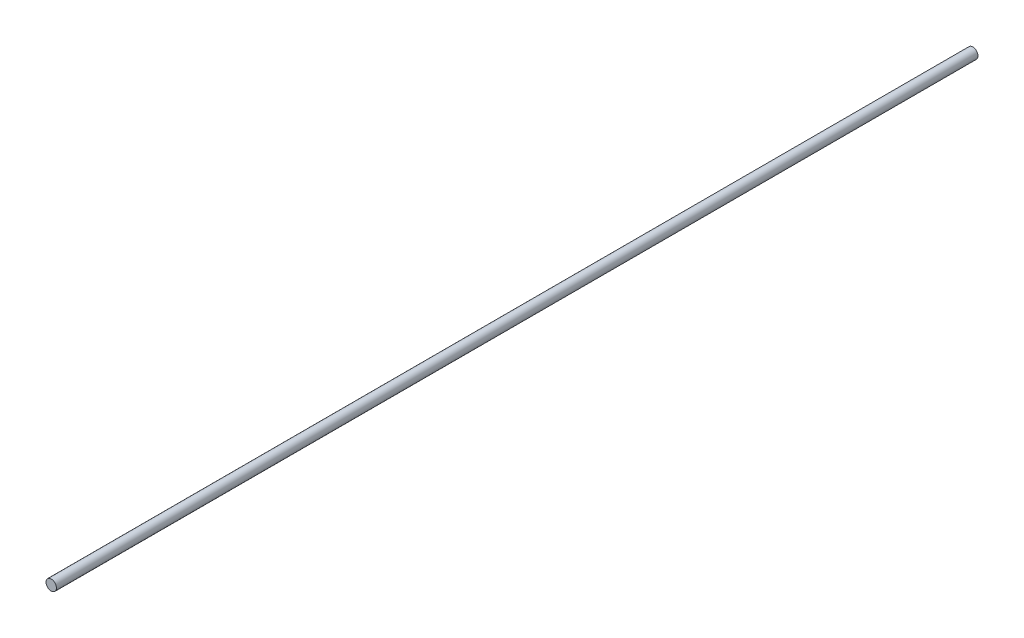
from build123d import *

# Parameters (mm, degrees)
SKETCH1_R           = 4
BOSS_EXTRUDE1_DEPTH = 706


with BuildPart() as part:
    # Sketch1 → Boss-Extrude1 (new body)
    with BuildSketch(Plane.XY):
        Circle(SKETCH1_R)
    extrude(amount=BOSS_EXTRUDE1_DEPTH)


solid = part.part
